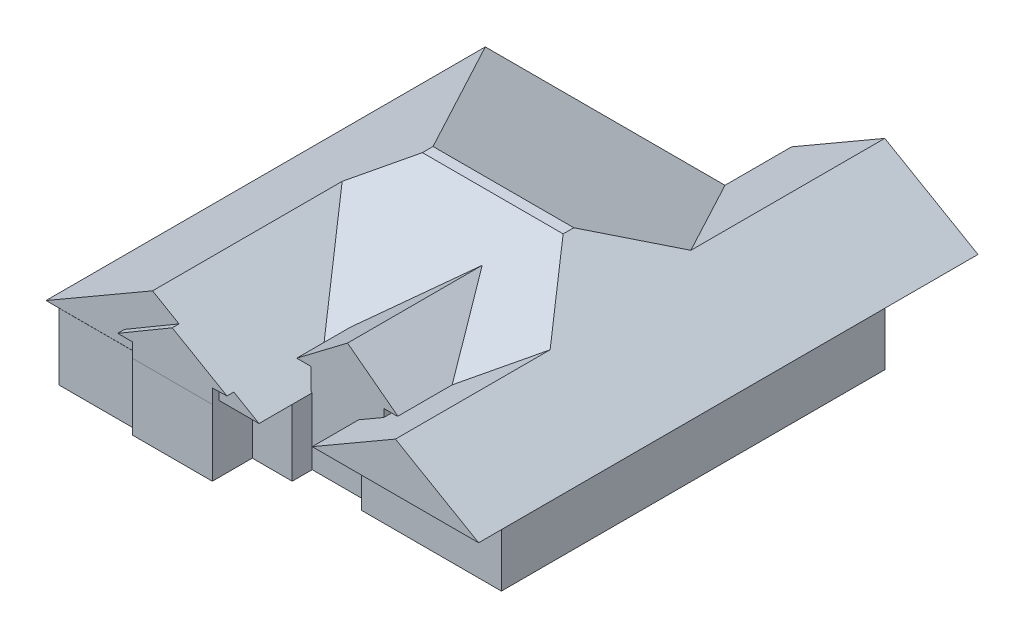
from build123d import *

# Parameters (mm, degrees)
BOSS_EXTRUDE1_DEPTH = 3048
BOSS_EXTRUDE2_START = -5486.4
BOSS_EXTRUDE2_DEPTH = 9144
BOSS_EXTRUDE4_DEPTH = 7315.2
BOSS_EXTRUDE5_DEPTH = 11294.618
BOSS_EXTRUDE6_DEPTH = 812.8
BOSS_EXTRUDE7_DEPTH = 9748.012
BOSS_EXTRUDE8_DEPTH = 311.658
SKETCH15_W          = 7315.2
SKETCH15_H          = 3048
CUT_EXTRUDE1_DEPTH  = 3654.044
SKETCH16_W          = 6400.8
SKETCH16_H          = 3048
CUT_EXTRUDE2_DEPTH  = 1651
CUT_EXTRUDE3_DEPTH  = 3048


with BuildPart() as part:
    # Sketch1 → Boss-Extrude1 (new body)
    with BuildSketch(Plane(origin=(0, 0, 0), x_dir=(1, 0, 0), z_dir=(0, 1, 0))):
        Polygon((9144, -9448.8), (2743.2, -9448.8), (2743.2, -6400.8), (0, -6400.8), (0, -8229.6), (-1828.8, -8229.6), (-1828.8, -9753.6), (-1828.8, -10058.4), (-5486.4, -10058.4), (-5486.4, -9753.6), (-9144, -9753.6), (-9144, 9753.6), (9144, 9753.6), align=None)
    extrude(amount=BOSS_EXTRUDE1_DEPTH)

    # Boundary7: read off the stored shape, not the designer's step
    # Boundary7: loft between two sections, ruled curve by curve
    boundary7_from = [
        Edge.make_line((-3221.736, 6827.52, -1438.656), (3221.736, 6827.52, -1438.656)),
        Edge.make_line((3221.736, 6827.52, -1438.656), (3221.736, 6827.52, -950.976)),
        Edge.make_line((-3221.736, 6827.52, -950.976), (-3221.736, 6827.52, -1438.656)),
        Edge.make_line((-3221.736, 6827.52, -950.976), (3221.736, 6827.52, -950.976)),
    ]
    boundary7_to = [
        Edge.make_line((-9753.6, 3048, -10363.2), (9753.6, 3048, -10363.2)),
        Edge.make_line((9753.6, 3048, -10363.2), (9753.6, 3048, 7010.4)),
        Edge.make_line((-9753.6, 3048, 7010.4), (-9753.6, 3048, -10363.2)),
        Edge.make_line((-9753.6, 3048, 7010.4), (9753.6, 3048, 7010.4)),
    ]
    boundary7 = Solid(Shell([*[Face.make_surface_from_curves(boundary7_from[k], boundary7_to[k]) for k in range(4)], Face(Wire(boundary7_from)), Face(Wire(boundary7_to))]))
    add(boundary7)

    # Sketch5 → Boss-Extrude2 (add)
    with BuildSketch(Plane(origin=(0, 0, -9753.6), x_dir=(-1, 0, 0), z_dir=(0, 0, -1)).offset(BOSS_EXTRUDE2_START)):
        Polygon((-9144, 0), (-1828.8, 0), (-1828.8, 3048), (-1219.2, 3048), (-5486.4, 5517.121791881), (-9753.6, 3048), (-9144, 3048), align=None)
    extrude(amount=BOSS_EXTRUDE2_DEPTH)

    # Sketch9 → Boss-Extrude4 (add)
    with BuildSketch(Plane.XY):
        Polygon((3279.648, 0), (-44.704, 0), (-44.704, 4067.405922576), (-708.94759912, 4067.405922576), (1617.472, 5830.039231191), (3943.89159912, 4067.405922576), (3279.648, 4067.405922576), align=None)
    extrude(amount=BOSS_EXTRUDE4_DEPTH)

    # Sketch7 → Boss-Extrude5 (add)
    with BuildSketch(Plane.XY.offset(9448.8)):
        Polygon((2743.2, 0), (9144, 0), (9144, 3048), (9753.6, 3048), (5943.6, 5252.573028465), (2133.6, 3048), (2743.2, 3048), align=None)
    extrude(amount=-BOSS_EXTRUDE5_DEPTH)

    # Sketch11 → Boss-Extrude6 (add)
    with BuildSketch(Plane.XY):
        Polygon((-9753.6, 3048), (46.156697944, 3048), (-4853.721651028, 5883.207257454), align=None)
    extrude(amount=BOSS_EXTRUDE6_DEPTH)

    # Sketch12 → Boss-Extrude7 (add)
    with BuildSketch(Plane.XY):
        Polygon((-9753.6, 3048), (0, 3048), (-4876.8, 5869.853476435), align=None)
    extrude(amount=BOSS_EXTRUDE7_DEPTH)

    # Sketch13 → Boss-Extrude8 (add)
    with BuildSketch(Plane.XY.offset(9748.012)):
        Polygon((-1828.8, 3048), (-1828.8, 3700.230424559), (-1157.256283504, 3717.620994655), (-3662.784348589, 5167.389917055), (-6158.168855406, 3700.230424559), (-5486.4, 3700.230424559), (-5486.4, 3048), align=None)
    extrude(amount=BOSS_EXTRUDE8_DEPTH)

    # Sketch15 → Cut-Extrude1 (cut)
    with BuildSketch(Plane(origin=(0, 0, -13411.2), x_dir=(-1, 0, 0), z_dir=(0, 0, -1))):
        with Locations((-5486.4, 1524)):
            Rectangle(SKETCH15_W, SKETCH15_H)
    extrude(amount=-CUT_EXTRUDE1_DEPTH, mode=Mode.SUBTRACT)

    # Sketch16 → Cut-Extrude2 (cut)
    with BuildSketch(Plane.XY.offset(9448.8)):
        with Locations((5943.6, 1524)):
            Rectangle(SKETCH16_W, SKETCH16_H)
    extrude(amount=-CUT_EXTRUDE2_DEPTH, mode=Mode.SUBTRACT)

    # Sketch17 → Cut-Extrude3 (cut)
    with BuildSketch(Plane.XZ):
        Polygon((-8763, 9372.6), (-8763, -9372.6), (8763, -9372.6), (8763, 7416.8), (3124.2, 7416.8), (3124.2, 6934.2), (-381, 6934.2), (-381, 7848.6), (-2209.8, 7848.6), (-2209.8, 9677.4), (-5105.4, 9677.4), (-5105.4, 9372.6), align=None)
    extrude(amount=-CUT_EXTRUDE3_DEPTH, mode=Mode.SUBTRACT)


solid = part.part
